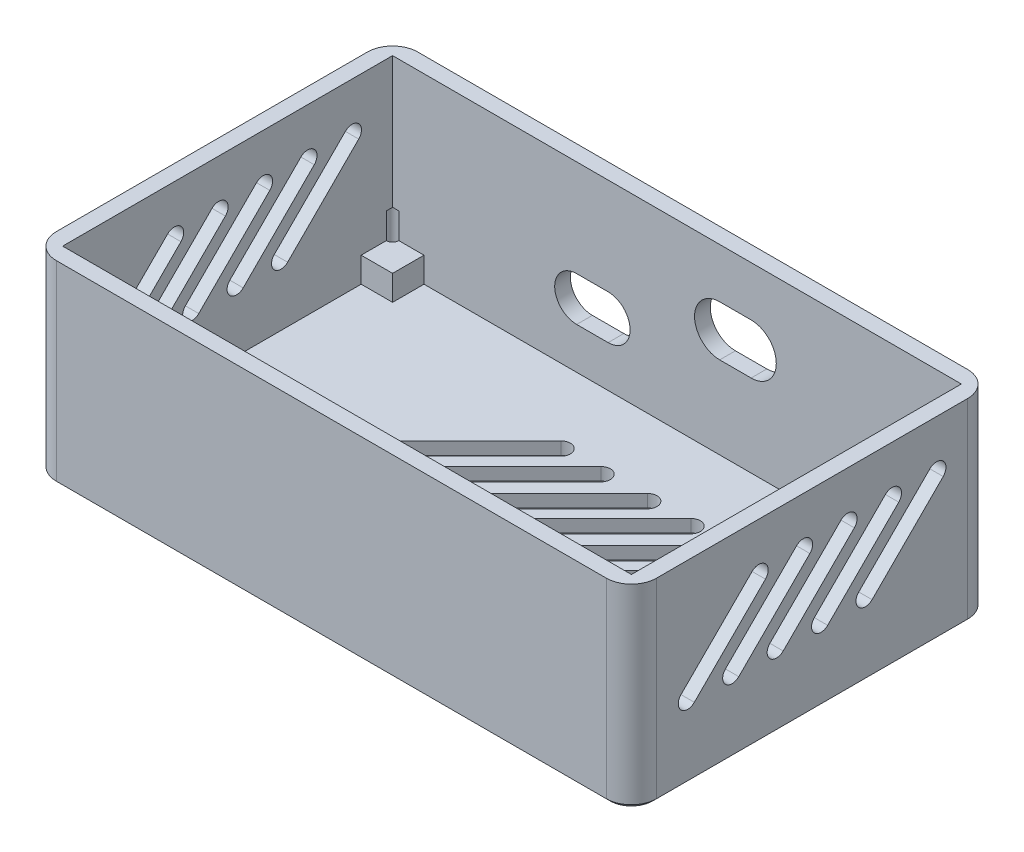
from build123d import *

# Parameters (mm, degrees)
CUERPO_DEPTH                  = 31
CROQUIS_HUECO_PCB_W           = 90.5
CROQUIS_HUECO_PCB_H           = 52.5
HUECO_PCB_DEPTH               = 29
CROQUIS_APOYOS_W              = 5
CROQUIS_APOYOS_H              = 5
APOYOS_PCB_DEPTH              = 4
CROQUIS_ALIVIOS_R             = 1
ALIVIOS_ESQUINAS_DEPTH        = 8.1
SALIDAS_USB_Y_PANEL_DEPTH     = 64.777935056
VENTILAS_LATERALES_DEPTH      = 64.777935056
VENTILAS_LATERALES_DEPTH_BACK = 64.777935056
REJILLA_PISO_DEPTH            = 2
CHAFLAN_BASE_SIZE             = 0.6


with BuildPart() as part:
    # Croquis_contorno → Cuerpo (new body)
    with BuildSketch(Plane(origin=(0, 0, 0), x_dir=(1, 0, 0), z_dir=(0, 1, 0))):
        with BuildLine():
            Line((-43.75, -28.75), (43.75, -28.75))
            ThreePointArc((43.75, -28.75), (46.578427125, -27.578427125), (47.75, -24.75))
            Line((47.75, -24.75), (47.75, 24.75))
            ThreePointArc((47.75, 24.75), (46.578427125, 27.578427125), (43.75, 28.75))
            Line((43.75, 28.75), (-43.75, 28.75))
            ThreePointArc((-43.75, 28.75), (-46.578427125, 27.578427125), (-47.75, 24.75))
            Line((-47.75, 24.75), (-47.75, -24.75))
            ThreePointArc((-47.75, -24.75), (-46.578427125, -27.578427125), (-43.75, -28.75))
        make_face()
    extrude(amount=CUERPO_DEPTH)

    # Croquis_hueco_PCB → Hueco_PCB (cut)
    with BuildSketch(Plane(origin=(0, 31, 0), x_dir=(1, 0, 0), z_dir=(0, 1, 0))):
        Rectangle(CROQUIS_HUECO_PCB_W, CROQUIS_HUECO_PCB_H)
    extrude(amount=-HUECO_PCB_DEPTH, mode=Mode.SUBTRACT)

    # Croquis_apoyos → Apoyos_PCB (add)
    with BuildSketch(Plane(origin=(0, 2, 0), x_dir=(1, 0, 0), z_dir=(0, 1, 0))):
        with Locations((-42.75, -23.75)):
            Rectangle(CROQUIS_APOYOS_W, CROQUIS_APOYOS_H)
        with Locations((-42.75, 23.75)):
            Rectangle(CROQUIS_APOYOS_W, CROQUIS_APOYOS_H)
        with Locations((42.75, -23.75)):
            Rectangle(CROQUIS_APOYOS_W, CROQUIS_APOYOS_H)
        with Locations((42.75, 23.75)):
            Rectangle(CROQUIS_APOYOS_W, CROQUIS_APOYOS_H)
    extrude(amount=APOYOS_PCB_DEPTH)

    # Croquis_alivios → Alivios_esquinas (cut)
    with BuildSketch(Plane(origin=(0, 2, 0), x_dir=(1, 0, 0), z_dir=(0, 1, 0))):
        with Locations((-45.25, -26.25)):
            Circle(CROQUIS_ALIVIOS_R)
        with Locations((-45.25, 26.25)):
            Circle(CROQUIS_ALIVIOS_R)
        with Locations((45.25, -26.25)):
            Circle(CROQUIS_ALIVIOS_R)
        with Locations((45.25, 26.25)):
            Circle(CROQUIS_ALIVIOS_R)
    extrude(amount=ALIVIOS_ESQUINAS_DEPTH, mode=Mode.SUBTRACT)

    # Croquis_salidas → Salidas_USB_y_panel (cut, through all)
    with BuildSketch(Plane.XY):
        with BuildLine():
            Line((6.8, 23.1), (11.8, 23.1))
            ThreePointArc((11.8, 23.1), (15.8, 19.1), (11.8, 15.1))
            Line((11.8, 15.1), (6.8, 15.1))
            ThreePointArc((6.8, 15.1), (2.8, 19.1), (6.8, 23.1))
        make_face()
        with BuildLine():
            Line((-15.96, 15.6), (-10.96, 15.6))
            ThreePointArc((-10.96, 15.6), (-7.46, 12.1), (-10.96, 8.6))
            Line((-10.96, 8.6), (-15.96, 8.6))
            ThreePointArc((-15.96, 8.6), (-19.46, 12.1), (-15.96, 15.6))
        make_face()
    extrude(amount=-SALIDAS_USB_Y_PANEL_DEPTH, mode=Mode.SUBTRACT)

    # Croquis_ventilas → Ventilas_laterales (cut, two sides: drawn at the far end of the back side and taken through both)
    with BuildSketch(Plane(origin=(0, 0, 0), x_dir=(0, 0, -1), z_dir=(1, 0, 0)).offset(-VENTILAS_LATERALES_DEPTH_BACK)):
        with BuildLine():
            Line((-20.859650045, 13.003805922), (-9.545941546, 24.317514421))
            ThreePointArc((-9.545941546, 24.317514421), (-7.424621202, 24.317514421), (-7.424621202, 22.196194078))
            Line((-7.424621202, 22.196194078), (-18.738329701, 10.882485579))
            ThreePointArc((-18.738329701, 10.882485579), (-20.859650045, 10.882485579), (-20.859650045, 13.003805922))
        make_face()
        with BuildLine():
            Line((-13.788582233, 13.003805922), (-2.474873734, 24.317514421))
            ThreePointArc((-2.474873734, 24.317514421), (-0.353553391, 24.317514421), (-0.353553391, 22.196194078))
            Line((-0.353553391, 22.196194078), (-11.66726189, 10.882485579))
            ThreePointArc((-11.66726189, 10.882485579), (-13.788582233, 10.882485579), (-13.788582233, 13.003805922))
        make_face()
        with BuildLine():
            Line((-6.717514421, 13.003805922), (4.596194078, 24.317514421))
            ThreePointArc((4.596194078, 24.317514421), (6.717514421, 24.317514421), (6.717514421, 22.196194078))
            Line((6.717514421, 22.196194078), (-4.596194078, 10.882485579))
            ThreePointArc((-4.596194078, 10.882485579), (-6.717514421, 10.882485579), (-6.717514421, 13.003805922))
        make_face()
        with BuildLine():
            Line((0.353553391, 13.003805922), (11.66726189, 24.317514421))
            ThreePointArc((11.66726189, 24.317514421), (13.788582233, 24.317514421), (13.788582233, 22.196194078))
            Line((13.788582233, 22.196194078), (2.474873734, 10.882485579))
            ThreePointArc((2.474873734, 10.882485579), (0.353553391, 10.882485579), (0.353553391, 13.003805922))
        make_face()
        with BuildLine():
            Line((7.424621202, 13.003805922), (18.738329701, 24.317514421))
            ThreePointArc((18.738329701, 24.317514421), (20.859650045, 24.317514421), (20.859650045, 22.196194078))
            Line((20.859650045, 22.196194078), (9.545941546, 10.882485579))
            ThreePointArc((9.545941546, 10.882485579), (7.424621202, 10.882485579), (7.424621202, 13.003805922))
        make_face()
    extrude(amount=VENTILAS_LATERALES_DEPTH + VENTILAS_LATERALES_DEPTH_BACK, mode=Mode.SUBTRACT)

    # Croquis_rejilla_piso → Rejilla_piso (cut)
    with BuildSketch(Plane(origin=(0, 0, 0), x_dir=(1, 0, 0), z_dir=(0, 1, 0))):
        with BuildLine():
            Line((-36.769552622, -13.435028843), (-7.778174593, 15.556349186))
            ThreePointArc((-7.778174593, 15.556349186), (-5.656854249, 15.556349186), (-5.656854249, 13.435028843))
            Line((-5.656854249, 13.435028843), (-34.648232278, -15.556349186))
            ThreePointArc((-34.648232278, -15.556349186), (-36.769552622, -15.556349186), (-36.769552622, -13.435028843))
        make_face()
        with BuildLine():
            Line((-29.69848481, -13.435028843), (-1.060660172, 15.202795796))
            ThreePointArc((-1.060660172, 15.202795796), (1.060660172, 15.202795796), (1.060660172, 13.081475452))
            Line((1.060660172, 13.081475452), (-27.577164466, -15.556349186))
            ThreePointArc((-27.577164466, -15.556349186), (-29.69848481, -15.556349186), (-29.69848481, -13.435028843))
        make_face()
        with BuildLine():
            Line((-22.273863607, -13.435028843), (6.363961031, 15.202795796))
            ThreePointArc((6.363961031, 15.202795796), (8.485281374, 15.202795796), (8.485281374, 13.081475452))
            Line((8.485281374, 13.081475452), (-20.152543264, -15.556349186))
            ThreePointArc((-20.152543264, -15.556349186), (-22.273863607, -15.556349186), (-22.273863607, -13.435028843))
        make_face()
        with BuildLine():
            Line((-15.379572491, -13.435028843), (13.258252147, 15.202795796))
            ThreePointArc((13.258252147, 15.202795796), (15.379572491, 15.202795796), (15.379572491, 13.081475452))
            Line((15.379572491, 13.081475452), (-13.258252147, -15.556349186))
            ThreePointArc((-13.258252147, -15.556349186), (-15.379572491, -15.556349186), (-15.379572491, -13.435028843))
        make_face()
        with BuildLine():
            Line((-7.954951288, -13.435028843), (20.68287335, 15.202795796))
            ThreePointArc((20.68287335, 15.202795796), (22.804193693, 15.202795796), (22.804193693, 13.081475452))
            Line((22.804193693, 13.081475452), (-5.833630945, -15.556349186))
            ThreePointArc((-5.833630945, -15.556349186), (-7.954951288, -15.556349186), (-7.954951288, -13.435028843))
        make_face()
        with BuildLine():
            Line((-1.060660172, -13.435028843), (27.577164466, 15.202795796))
            ThreePointArc((27.577164466, 15.202795796), (29.69848481, 15.202795796), (29.69848481, 13.081475452))
            Line((29.69848481, 13.081475452), (1.060660172, -15.556349186))
            ThreePointArc((1.060660172, -15.556349186), (-1.060660172, -15.556349186), (-1.060660172, -13.435028843))
        make_face()
        with BuildLine():
            Line((5.303300859, -13.435028843), (34.471455583, 15.733125881))
            ThreePointArc((34.471455583, 15.733125881), (36.592775926, 15.733125881), (36.592775926, 13.611805538))
            Line((36.592775926, 13.611805538), (7.424621202, -15.556349186))
            ThreePointArc((7.424621202, -15.556349186), (5.303300859, -15.556349186), (5.303300859, -13.435028843))
        make_face()
    extrude(amount=REJILLA_PISO_DEPTH, mode=Mode.SUBTRACT)

    # Chaflan_base
    chaflan_base_edges = [part.edges().sort_by_distance(p)[0] for p in [
        (0, 0, 28.75),
        (46.578427125, 0, 27.578427125),
        (47.75, 0, 0),
        (46.578427125, 0, -27.578427125),
        (0, 0, -28.75),
        (-46.578427125, 0, -27.578427125),
        (-47.75, 0, 0),
        (-46.578427125, 0, 27.578427125),
    ]]
    chamfer(chaflan_base_edges, length=CHAFLAN_BASE_SIZE)


solid = part.part
